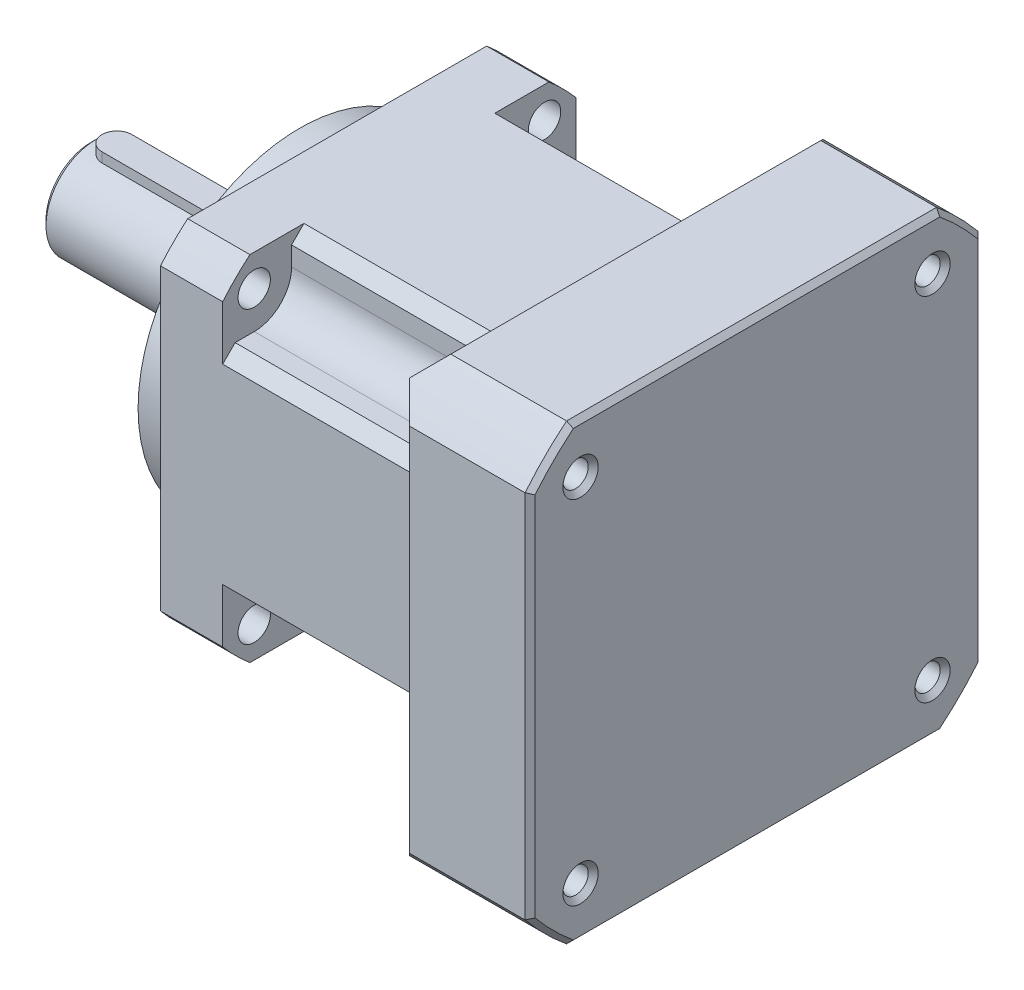
from build123d import *

# Parameters (mm, degrees)
SKETCH_1_W                   = 142
SKETCH_1_H                   = 142
EXTRUDE_1_DEPTH              = 25
CUT_EXTRUDE_START            = -25
CUT_EXTRUDE_1_OUTLINE_R      = 6.5
CUT_EXTRUDE_1_DEPTH          = 25
SKETCH_9_R                   = 65
EXTRUDE_7_DEPTH              = 15
SKETCH_12_R                  = 25
EXTRUDE_10_DEPTH             = 3
SKETCH_10_R                  = 20
EXTRUDE_8_DEPTH              = 81
CHAMFER_4_SIZE               = 2
CUT_EXTRUDE_2_DEPTH          = 12
EXTRUDE_9_DEPTH              = 12
EXTRUDE_5_DEPTH              = 75
EXTRUDE_11_DEPTH             = 10
EXTRUDE_6_DEPTH              = 58.5
CHAMFER_6_SIZE               = 10
HOLE_WIZARD_M12_1_AT_2_COUNT = 2
HOLE_WIZARD_M12_1_AT_2_PITCH = 141.421356237
HOLE_WIZARD_M12_1_AT_3_COUNT = 2
HOLE_WIZARD_M12_1_AT_3_PITCH = 200
HOLE_WIZARD_M12_1_AT_4_COUNT = 2
HOLE_WIZARD_M12_1_AT_4_PITCH = 141.421356237
CHAMFER_5_SIZE               = 2
SCALE_1_SCALE                = 0.5934


# Read off the part's stored shape, not the designer's step: 除料-伸長1
with BuildPart() as part:
    # 草圖1 → 伸長1 (new body)
    with BuildSketch(Plane(origin=(0, 0, 0), x_dir=(0, 0, -1), z_dir=(1, 0, 0))):
        Rectangle(SKETCH_1_W, SKETCH_1_H)
    extrude(amount=EXTRUDE_1_DEPTH)

    # 除料-伸長1 outline → 除料-伸長1 (cut)
    with BuildSketch(Plane.ZY.offset(CUT_EXTRUDE_START)):
        with Locations((-58.336309448, -58.336309448)):
            Circle(CUT_EXTRUDE_1_OUTLINE_R)
        with Locations((58.336309448, -58.336309448)):
            Circle(CUT_EXTRUDE_1_OUTLINE_R)
        with Locations((58.336309448, 58.336309448)):
            Circle(CUT_EXTRUDE_1_OUTLINE_R)
        with Locations((-58.336309448, 58.336309448)):
            Circle(CUT_EXTRUDE_1_OUTLINE_R)
        with BuildLine():
            ThreePointArc((-71, 60.066629671), (-65.76093065, 65.76093065), (-60.066629671, 71))
            Line((-60.066629671, 71), (-71, 71))
            Line((-71, 71), (-71, 60.066629671))
        make_face()
        with BuildLine():
            Line((71, 71), (60.066629671, 71))
            ThreePointArc((60.066629671, 71), (65.76093065, 65.76093065), (71, 60.066629671))
            Line((71, 60.066629671), (71, 71))
        make_face()
        with BuildLine():
            ThreePointArc((-60.066629671, -71), (-65.76093065, -65.76093065), (-71, -60.066629671))
            Line((-71, -60.066629671), (-71, -71))
            Line((-71, -71), (-60.066629671, -71))
        make_face()
        with BuildLine():
            Line((71, -71), (71, -60.066629671))
            ThreePointArc((71, -60.066629671), (65.76093065, -65.76093065), (60.066629671, -71))
            Line((60.066629671, -71), (71, -71))
        make_face()
    extrude(amount=CUT_EXTRUDE_1_DEPTH, mode=Mode.SUBTRACT)

    # 草圖9 → 伸長7 (add)
    with BuildSketch(Plane.ZY):
        with Locations(Location((0, 0, 0), (0, 0, 180))):
            Circle(SKETCH_9_R)
    extrude(amount=EXTRUDE_7_DEPTH)

    # 草圖12 → 伸長10 (add)
    with BuildSketch(Plane.ZY.offset(15)):
        Circle(SKETCH_12_R)
    extrude(amount=EXTRUDE_10_DEPTH)

    # 草圖10 → 伸長8 (add)
    with BuildSketch(Plane.ZY.offset(18)):
        Circle(SKETCH_10_R)
    extrude(amount=EXTRUDE_8_DEPTH)

    # 導角4
    chamfer_4_edges = [part.edges().sort_by_distance(p)[0] for p in [
        (-99, 0, -20),
    ]]
    chamfer(chamfer_4_edges, length=CHAMFER_4_SIZE)

    # 草圖7 → 除料-伸長2 (cut)
    with BuildSketch(Plane(origin=(0, 11, 0), x_dir=(-1, 0, 0), z_dir=(0, 1, 0))):
        with BuildLine():
            Line((35.5, -6), (88.5, -6))
            ThreePointArc((88.5, -6), (94.5, 0), (88.5, 6))
            Line((88.5, 6), (35.5, 6))
            ThreePointArc((35.5, 6), (29.5, 0), (35.5, -6))
        make_face()
    extrude(amount=CUT_EXTRUDE_2_DEPTH, mode=Mode.SUBTRACT)

    # 草圖13 → M16 螺紋孔1 (revolve, cut)
    with BuildSketch(Plane(origin=(-99, 0, 0), x_dir=(0, 0, 1), z_dir=(0, 1, 0))):
        Polygon((0, 0), (0, 46.206024333), (7, 42), (7, 0), align=None)
    revolve(axis=Axis((-105.35, 0, 0), (1, 0, 0)), mode=Mode.SUBTRACT)

    # 草圖2 → 伸長5 (add)
    with BuildSketch(Plane(origin=(25, 0, 0), x_dir=(0, 0, -1), z_dir=(1, 0, 0))):
        with BuildLine():
            Line((-43.336309448, 58.336309448), (-43.336309448, 66))
            Line((-43.336309448, 66), (-38.336309448, 71))
            Line((-38.336309448, 71), (38.336309448, 71))
            Line((38.336309448, 71), (43.336309448, 66))
            Line((43.336309448, 66), (43.336309448, 58.336309448))
            ThreePointArc((43.336309448, 58.336309448), (47.72970773, 47.72970773), (58.336309448, 43.336309448))
            Line((58.336309448, 43.336309448), (66, 43.336309448))
            Line((66, 43.336309448), (71, 38.336309448))
            Line((71, 38.336309448), (71, -38.336309448))
            Line((71, -38.336309448), (66, -43.336309448))
            Line((66, -43.336309448), (58.336309448, -43.336309448))
            ThreePointArc((58.336309448, -43.336309448), (47.72970773, -47.72970773), (43.336309448, -58.336309448))
            Line((43.336309448, -58.336309448), (43.336309448, -66))
            Line((43.336309448, -66), (38.336309448, -71))
            Line((38.336309448, -71), (-38.336309448, -71))
            Line((-38.336309448, -71), (-43.336309448, -66))
            Line((-43.336309448, -66), (-43.336309448, -58.336309448))
            ThreePointArc((-43.336309448, -58.336309448), (-47.72970773, -47.72970773), (-58.336309448, -43.336309448))
            Line((-58.336309448, -43.336309448), (-66, -43.336309448))
            Line((-66, -43.336309448), (-71, -38.336309448))
            Line((-71, -38.336309448), (-71, 38.336309448))
            Line((-71, 38.336309448), (-66, 43.336309448))
            Line((-66, 43.336309448), (-58.336309448, 43.336309448))
            ThreePointArc((-58.336309448, 43.336309448), (-47.72970773, 47.72970773), (-43.336309448, 58.336309448))
        make_face()
    extrude(amount=EXTRUDE_5_DEPTH)

    # 草圖16 → 伸長11 (add)
    with BuildSketch(Plane(origin=(100, 0, 0), x_dir=(0, 0, -1), z_dir=(1, 0, 0))):
        with BuildLine():
            Line((-71, 38.336309448), (-71, -38.336309448))
            ThreePointArc((-71, -38.336309448), (-57.055554603, -57.055554603), (-38.336309448, -71))
            Line((-38.336309448, -71), (38.336309448, -71))
            ThreePointArc((38.336309448, -71), (57.055554603, -57.055554603), (71, -38.336309448))
            Line((71, -38.336309448), (71, 38.336309448))
            ThreePointArc((71, 38.336309448), (57.055554603, 57.055554603), (38.336309448, 71))
            Line((38.336309448, 71), (-38.336309448, 71))
            ThreePointArc((-38.336309448, 71), (-57.055554603, 57.055554603), (-71, 38.336309448))
        make_face()
    extrude(amount=EXTRUDE_11_DEPTH)

    # 草圖8 → 伸長6 (add)
    with BuildSketch(Plane(origin=(110, 0, 0), x_dir=(0, 0, -1), z_dir=(1, 0, 0))):
        with BuildLine():
            Line((-74.3320254, 91), (74.3320254, 91))
            ThreePointArc((74.3320254, 91), (83.085046789, 83.085046789), (91, 74.3320254))
            Line((91, 74.3320254), (91, -74.3320254))
            ThreePointArc((91, -74.3320254), (83.085046789, -83.085046789), (74.3320254, -91))
            Line((74.3320254, -91), (-74.3320254, -91))
            ThreePointArc((-74.3320254, -91), (-83.085046789, -83.085046789), (-91, -74.3320254))
            Line((-91, -74.3320254), (-91, 74.3320254))
            ThreePointArc((-91, 74.3320254), (-83.085046789, 83.085046789), (-74.3320254, 91))
        make_face()
    extrude(amount=EXTRUDE_6_DEPTH)

    # 導角6
    # the kernel refuses this chamfer: 10 mm, written as the material it takes off along each edge
    with BuildSketch(Plane(origin=(110, 100.048855279, -91), x_dir=(-0.027495876610586317, 0, 0.9996219169112968), z_dir=(0, -1, 0)), Plane(origin=(110, -91, -100.048855279), x_dir=(-0.027495876610586317, 0.9996219169112968, 0), z_dir=(0, 0, 1)), Plane(origin=(110, 91, 100.048855279), x_dir=(-0.027495876610586317, -0.9996219169112968, 0), z_dir=(0, 0, -1))) as chamfer_6_piece_1:
        Polygon((CHAMFER_6_SIZE * 0.999621916911, -CHAMFER_6_SIZE * 0.0274958766106), (-CHAMFER_6_SIZE * 0.0274958766106, -CHAMFER_6_SIZE * 0.999621916911), (0, 0), align=None)
    extrude(amount=200.097710558, mode=Mode.SUBTRACT)
    with BuildSketch(Plane(origin=(110, -100.048855279, 91), x_dir=(0.9996219169112968, 0, 0.027495876610586317), z_dir=(0, 1, 0))) as chamfer_6_piece_2:
        Polygon((CHAMFER_6_SIZE * 0.999621916911, CHAMFER_6_SIZE * 0.0274958766106), (-CHAMFER_6_SIZE * 0.0274958766106, CHAMFER_6_SIZE * 0.999621916911), (0, 0), align=None)
    extrude(amount=200.097710558, mode=Mode.SUBTRACT)

    # 草圖17 → M12 螺紋孔1 (revolve, cut)
    with BuildSketch(Plane(origin=(168.5, 70.710678119, 70.710678119), x_dir=(0, 0, -1), z_dir=(0, 1, 0))):
        Polygon((0, 0), (0, 35.814389157), (5.1, 32.75), (5.1, 0), align=None)
    hole_wizard_m12_1 = revolve(axis=Axis((174.85, 70.710678119, 70.710678119), (-1, 0, 0)), mode=Mode.SUBTRACT)

    # M12 螺紋孔1 at 2: M12 螺紋孔1 ×2
    with Locations(*[(0, -i * HOLE_WIZARD_M12_1_AT_2_PITCH, 0) for i in range(1, HOLE_WIZARD_M12_1_AT_2_COUNT)]):
        add(hole_wizard_m12_1, mode=Mode.SUBTRACT)

    # M12 螺紋孔1 at 3: M12 螺紋孔1 ×2
    with Locations(*[Vector(0, -0.7071067811865476, -0.7071067811865476) * (i * HOLE_WIZARD_M12_1_AT_3_PITCH) for i in range(1, HOLE_WIZARD_M12_1_AT_3_COUNT)]):
        add(hole_wizard_m12_1, mode=Mode.SUBTRACT)

    # M12 螺紋孔1 at 4: M12 螺紋孔1 ×2
    with Locations(*[(0, 0, -i * HOLE_WIZARD_M12_1_AT_4_PITCH) for i in range(1, HOLE_WIZARD_M12_1_AT_4_COUNT)]):
        add(hole_wizard_m12_1, mode=Mode.SUBTRACT)

    # 導角5
    chamfer_5_edges = [part.edges().sort_by_distance(p)[0] for p in [
        (168.5, 83.085046789, -83.085046789),
        (168.5, 91, 0),
        (168.5, 83.085046789, 83.085046789),
        (168.5, 0, 91),
        (168.5, -83.085046789, 83.085046789),
        (168.5, -91, 0),
        (168.5, -83.085046789, -83.085046789),
        (168.5, 0, -91),
        (168.5, 70.710678119, -65.610678119),
        (168.5, -70.710678119, -65.610678119),
        (168.5, -70.710678119, 75.810678119),
        (168.5, 70.710678119, 75.810678119),
    ]]
    chamfer(chamfer_5_edges, length=CHAMFER_5_SIZE)


with BuildPart() as body_2:
    # 草圖11 → 伸長9 (new body)
    with BuildSketch(Plane(origin=(0, 11, 0), x_dir=(1, 0, 0), z_dir=(0, 1, 0))):
        with BuildLine():
            Line((-35.5, 6), (-88.5, 6))
            ThreePointArc((-88.5, 6), (-94.5, 0), (-88.5, -6))
            Line((-88.5, -6), (-35.5, -6))
            ThreePointArc((-35.5, -6), (-29.5, 0), (-35.5, 6))
        make_face()
    extrude(amount=EXTRUDE_9_DEPTH)


with BuildPart() as body_2_1:
    # 缩放比例1: scaled about (0, 0, 0)
    add(body_2.part.scale(SCALE_1_SCALE))


with BuildPart() as part_1:
    # 缩放比例1: scaled about (0, 0, 0)
    add(part.part.scale(SCALE_1_SCALE))


solid = Compound([body_2_1.part, part_1.part])
